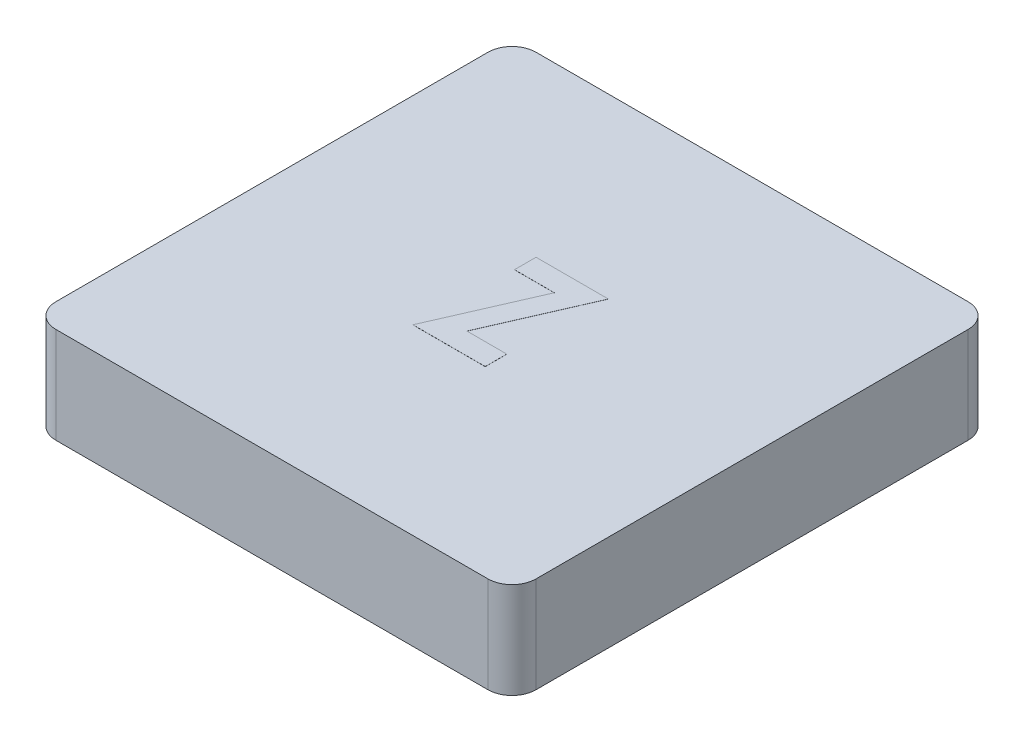
from build123d import *

# Parameters (mm, degrees)
SKETCH1_W           = 12.7
SKETCH1_H           = 12.7
BOSS_EXTRUDE1_DEPTH = 2.54
FILLET1_R           = 0.635
SHELL1_START        = 0.635
SHELL1_OUTLINE_W    = 1.905
SHELL1_OUTLINE_H    = 11.43
SHELL1_DEPTH        = 11.43
SKETCH2_R           = 2.54
BOSS_EXTRUDE2_DEPTH = 1.905
BOSS_EXTRUDE3_DEPTH = 0.00254


# Read off the part's stored shape, not the designer's step: Shell1
with BuildPart() as part:
    # Sketch1 → Boss-Extrude1 (new body)
    with BuildSketch(Plane(origin=(0, 0, 0), x_dir=(1, 0, 0), z_dir=(0, 1, 0))):
        with Locations((6.35, 6.35)):
            Rectangle(SKETCH1_W, SKETCH1_H)
    extrude(amount=BOSS_EXTRUDE1_DEPTH)

    # Fillet1
    fillet1_edges = [part.edges().sort_by_distance(p)[0] for p in [
        (0, 1.27, -12.7),
        (12.7, 1.27, -12.7),
        (12.7, 1.27, 0),
        (0, 1.27, 0),
    ]]
    fillet(fillet1_edges, radius=FILLET1_R)

    # Shell1 outline → Shell1 (cut)
    with BuildSketch(Plane.YZ.offset(SHELL1_START)):
        with Locations((0.9525, -6.35)):
            Rectangle(SHELL1_OUTLINE_W, SHELL1_OUTLINE_H)
    extrude(amount=SHELL1_DEPTH, mode=Mode.SUBTRACT)

    # Sketch2 → Boss-Extrude2 (add)
    with BuildSketch(Plane(origin=(0, 1.905, 0), x_dir=(-1, 0, 0), z_dir=(0, -1, 0))):
        with Locations(Location((-6.35, 6.35, 0), (0, 0, 270))):
            Circle(SKETCH2_R)
    extrude(amount=BOSS_EXTRUDE2_DEPTH)

    # Sketch3 → Boss-Extrude3 (add)
    with BuildSketch(Plane(origin=(0, 2.54, 0), x_dir=(1, 0, 0), z_dir=(0, 1, 0))):
        Polygon((5.334325641, 8.001), (7.247466667, 8.001), (6.110267147, 5.395871795), (7.16605641, 5.395871795), (7.16605641, 4.826), (5.252915385, 4.826), (6.390750921, 7.431128205), (5.334325641, 7.431128205), align=None)
    extrude(amount=BOSS_EXTRUDE3_DEPTH)


solid = part.part
